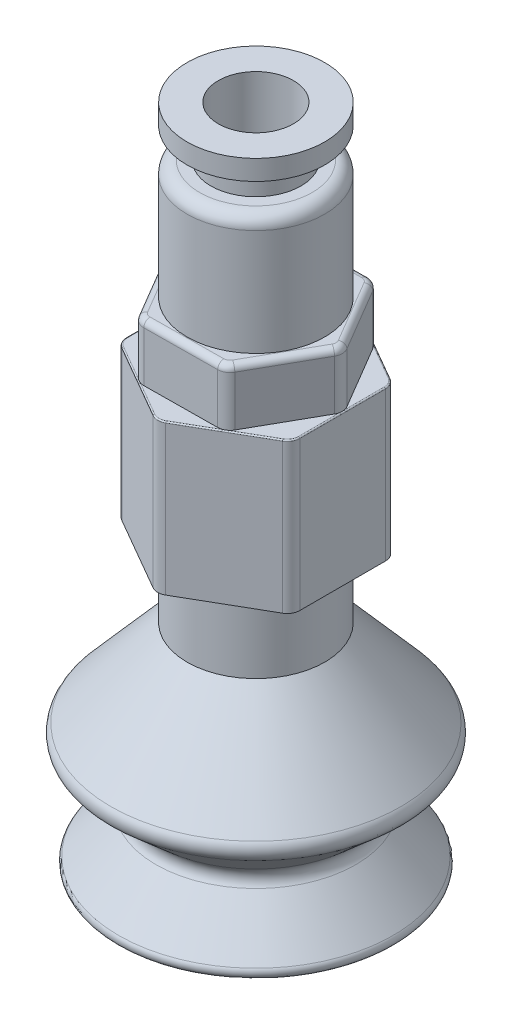
from build123d import *

# Parameters (mm, degrees)
CONG_1_R                        = 1
ENL_V_DE_MAT_EXTRU_MINCE1_DEPTH = 13
ENL_V_DE_MAT_EXTRU_MINCE2_DEPTH = 4.5
CONG_2_R                        = 1
CONG_3_R                        = 0.5
CONG_4_R                        = 0.1


with BuildPart() as part:
    # Esquisse1 → Révolution1 (revolve)
    with BuildSketch(Plane.XY, mode=Mode.PRIVATE) as r_volution1_sk:
        Polygon((0, 59.965448797), (3, 59.965448797), (3, 80.32940186), (5.5, 80.32940186), (5.5, 78.72940186), (3.9, 78.72940186), (3.9, 78.12940186), (3.599292622, 78.12940186), (3.599292622, 76.32940186), (5.5, 76.32940186), (5.5, 66.82940186), (7, 66.82940186), (7, 62.32940186), (8, 62.32940186), (8, 50.32940186), (5.5, 50.32940186), (5.5, 44.32940186), (12.25, 36.62940186), (7.329020529, 32.315556219), (11.7, 27.32940186), (9.370979471, 27.32940186), (5, 32.315556219), (9.920979471, 36.62940186), (3.170979471, 44.32940186), (3.170979471, 50.32940186), (0, 50.32940186), align=None)
    revolve(r_volution1_sk.sketch.rotate(Axis((0, 71.474862782, 0), (0, -1, 0)), 90), axis=Axis((0, 71.474862782, 0), (0, -1, 0)))

    # Congé1
    cong_1_edges = [part.edges().sort_by_distance(p)[0] for p in [
        (0, 32.315556219, -7.329020529),
        (0, 36.62940186, -12.25),
        (0, 76.32940186, -5.5),
    ]]
    fillet(cong_1_edges, radius=CONG_1_R)

    # Esquisse2 → Enlèv. de mat.-Extru.-Mince1 (cut)
    with BuildSketch(Plane(origin=(0, 62.32940186, 0), x_dir=(1, 0, 0), z_dir=(0, 1, 0))):
        Polygon((0, 31.094010768), (-26.92820323, 15.547005384), (-26.92820323, -15.547005384), (0, -31.094010768), (26.92820323, -15.547005384), (26.92820323, 15.547005384), align=None)
        Polygon((0, 8), (-6.92820323, 4), (-6.92820323, -4), (0, -8), (6.92820323, -4), (6.92820323, 4), align=None, mode=Mode.SUBTRACT)
    extrude(amount=-ENL_V_DE_MAT_EXTRU_MINCE1_DEPTH, mode=Mode.SUBTRACT)

    # Esquisse3 → Enlèv. de mat.-Extru.-Mince2 (cut)
    with BuildSketch(Plane(origin=(0, 66.82940186, 0), x_dir=(1, 0, 0), z_dir=(0, 1, 0))):
        Polygon((-15.296888339, 25.91630165), (-30.092619771, -0.289343076), (-14.795731431, -26.205644726), (15.296888339, -25.91630165), (30.092619771, 0.289343076), (14.795731431, 26.205644726), align=None)
        Polygon((-3.558123881, 6.028246383), (-6.999676448, -0.067302479), (-3.441552567, -6.095548862), (3.558123881, -6.028246383), (6.999676448, 0.067302479), (3.441552567, 6.095548862), align=None, mode=Mode.SUBTRACT)
    extrude(amount=-ENL_V_DE_MAT_EXTRU_MINCE2_DEPTH, mode=Mode.SUBTRACT)

    # Congé2
    # the kernel refuses this fillet: 1 mm, written as the material it takes off along each edge
    with BuildSketch(Plane(origin=(3.441552567, 68.272777533, -6.095548862), x_dir=(0.5083034115189873, 0, 0.8611780546659088), z_dir=(0, -1, 0)), Plane(origin=(6.999676448, 68.272777533, -0.067302479), x_dir=(-0.4916503667628478, 0, 0.8707926945386928), z_dir=(0, -1, 0)), Plane(origin=(3.558123881, 68.272777533, 6.028246383), x_dir=(-0.9999537782818346, 0, 0.009614639872783763), z_dir=(0, -1, 0)), Plane(origin=(-6.999676448, 68.272777533, 0.067302479), x_dir=(0.4916503667628478, 0, -0.8707926945386928), z_dir=(0, -1, 0)), Plane(origin=(-3.558123881, 68.272777533, -6.028246383), x_dir=(0.9999537782818346, 0, -0.009614639872783763), z_dir=(0, -1, 0))) as cong_2_piece_1:
        with BuildLine():
            CenterArc((CONG_2_R * 0.57735026919, CONG_2_R), CONG_2_R, 210, 60)
            Line((-CONG_2_R * 0.288675134595, CONG_2_R * 0.5), (0, 0))
            Line((0, 0), (CONG_2_R * 0.57735026919, 0))
        make_face()
    extrude(amount=5.943375673, mode=Mode.SUBTRACT)
    with BuildSketch(Plane(origin=(-3.441552567, 68.272777533, 6.095548862), x_dir=(0.9999537782818347, 0, -0.009614639872783772), z_dir=(0, -1, 0))) as cong_2_piece_2:
        with BuildLine():
            CenterArc((CONG_2_R * 0.57735026919, -CONG_2_R), CONG_2_R, 90, 60)
            Line((-CONG_2_R * 0.288675134595, -CONG_2_R * 0.5), (0, 0))
            Line((0, 0), (CONG_2_R * 0.57735026919, 0))
        make_face()
    extrude(amount=5.943375673, mode=Mode.SUBTRACT)
    with BuildSketch(Plane(origin=(6.92820323, 63.772777533, -4), x_dir=(0, 0, 1), z_dir=(0, -1, 0)), Plane(origin=(6.92820323, 63.772777533, 4), x_dir=(-0.8660254037844343, 0, 0.5000000000000073), z_dir=(0, -1, 0)), Plane(origin=(-6.92820323, 63.772777533, 4), x_dir=(0, 0, -1), z_dir=(0, -1, 0)), Plane(origin=(-6.92820323, 63.772777533, -4), x_dir=(0.8660254037844383, 0, -0.5000000000000008), z_dir=(0, -1, 0)), Plane(origin=(0, 63.772777533, -8), x_dir=(0.8660254037844421, 0, 0.4999999999999941), z_dir=(0, -1, 0))) as cong_2_piece_3:
        with BuildLine():
            CenterArc((CONG_2_R * 0.57735026919, CONG_2_R), CONG_2_R, 210, 60)
            Line((-CONG_2_R * 0.288675134595, CONG_2_R * 0.5), (0, 0))
            Line((0, 0), (CONG_2_R * 0.57735026919, 0))
        make_face()
    extrude(amount=14.886751346, mode=Mode.SUBTRACT)
    with BuildSketch(Plane(origin=(0, 63.772777533, 8), x_dir=(0.8660254037844343, 0, -0.5000000000000075), z_dir=(0, -1, 0))) as cong_2_piece_4:
        with BuildLine():
            CenterArc((CONG_2_R * 0.57735026919, -CONG_2_R), CONG_2_R, 90, 60)
            Line((-CONG_2_R * 0.288675134595, -CONG_2_R * 0.5), (0, 0))
            Line((0, 0), (CONG_2_R * 0.57735026919, 0))
        make_face()
    extrude(amount=14.886751346, mode=Mode.SUBTRACT)

    # Congé3
    cong_3_edges = [part.edges().sort_by_distance(p)[0] for p in [
        (0, 27.32940186, -11.7),
        (-0.058285657, 66.82940186, -6.061897622),
        (-5.278900164, 66.82940186, -2.980471952),
        (-5.220614508, 66.82940186, 3.08142567),
        (0.058285657, 66.82940186, 6.061897622),
        (5.278900164, 66.82940186, 2.980471952),
        (5.220614508, 66.82940186, -3.08142567),
        (-6.84498306, 66.82940186, 0.065815089),
        (-3.365493991, 66.82940186, 5.960836763),
        (3.479489069, 66.82940186, 5.895021674),
        (6.84498306, 66.82940186, -0.065815089),
        (3.365493991, 66.82940186, -5.960836763),
        (-3.479489069, 66.82940186, -5.895021674),
    ]]
    fillet(cong_3_edges, radius=CONG_3_R)

    # Congé4
    cong_4_edges = [part.edges().sort_by_distance(p)[0] for p in [
        (0, 62.32940186, -7.845299462),
        (6.794228634, 62.32940186, -3.922649731),
        (6.794228634, 62.32940186, 3.922649731),
        (0, 62.32940186, 7.845299462),
        (-6.794228634, 62.32940186, -3.922649731),
        (-6.794228634, 62.32940186, 3.922649731),
        (3.464101615, 62.32940186, -6),
        (6.92820323, 62.32940186, 0),
        (3.464101615, 62.32940186, 6),
        (-3.464101615, 62.32940186, 6),
        (-6.92820323, 62.32940186, 0),
        (-3.464101615, 62.32940186, -6),
    ]]
    fillet(cong_4_edges, radius=CONG_4_R)


solid = part.part
